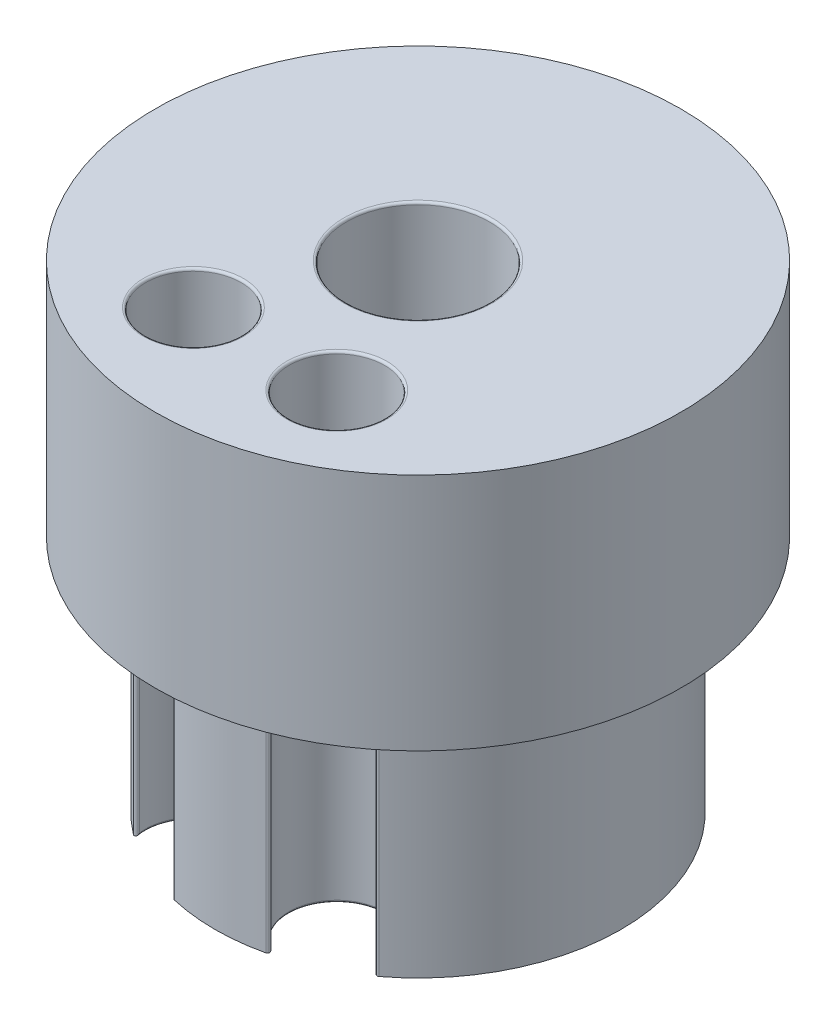
from build123d import *

# Parameters (mm, degrees)
SKETCH1_R           = 0.55
BOSS_EXTRUDE1_DEPTH = 0.5
SKETCH2_R           = 0.425
BOSS_EXTRUDE2_DEPTH = 0.5
SKETCH3_R           = 0.15
SKETCH3_R_2         = 0.1
CUT_EXTRUDE1_DEPTH  = 2.266885946
FILLET5_R           = 0.005


with BuildPart() as part:
    # Sketch1 → Boss-Extrude1 (new body)
    with BuildSketch(Plane(origin=(0, 0, 0), x_dir=(1, 0, 0), z_dir=(0, 1, 0))):
        Circle(SKETCH1_R)
    extrude(amount=-BOSS_EXTRUDE1_DEPTH)

    # Sketch2 → Boss-Extrude2 (add)
    with BuildSketch(Plane.XZ.offset(0.5)):
        Circle(SKETCH2_R)
    extrude(amount=BOSS_EXTRUDE2_DEPTH)

    # Sketch3 → Cut-Extrude1 (cut, through all)
    with BuildSketch(Plane(origin=(0, 0, 0), x_dir=(1, 0, 0), z_dir=(0, 1, 0))):
        Circle(SKETCH3_R)
        with Locations((0.15, -0.32)):
            Circle(SKETCH3_R_2)
        with Locations((-0.15, -0.32)):
            Circle(SKETCH3_R_2)
    extrude(amount=-CUT_EXTRUDE1_DEPTH, mode=Mode.SUBTRACT)

    # Fillet5
    fillet5_edges = [part.edges().sort_by_distance(p)[0] for p in [
        (-0.15, 0, 0),
        (-0.15, -1, 0),
        (0.05, 0, 0.32),
        (0.095958554, -1, 0.235860104),
        (-0.25, 0, 0.32),
        (-0.163220488, -1, 0.220877759),
        (0.246504374, -0.75, 0.346208887),
        (0.108409557, -0.75, 0.410940833),
        (0.192443388, -0.5, 0.410545894),
        (-0.108409557, -0.75, 0.410940833),
        (-0.246504374, -0.75, 0.346208887),
        (-0.192443388, -0.5, 0.410545894),
    ]]
    fillet(fillet5_edges, radius=FILLET5_R)


solid = part.part
